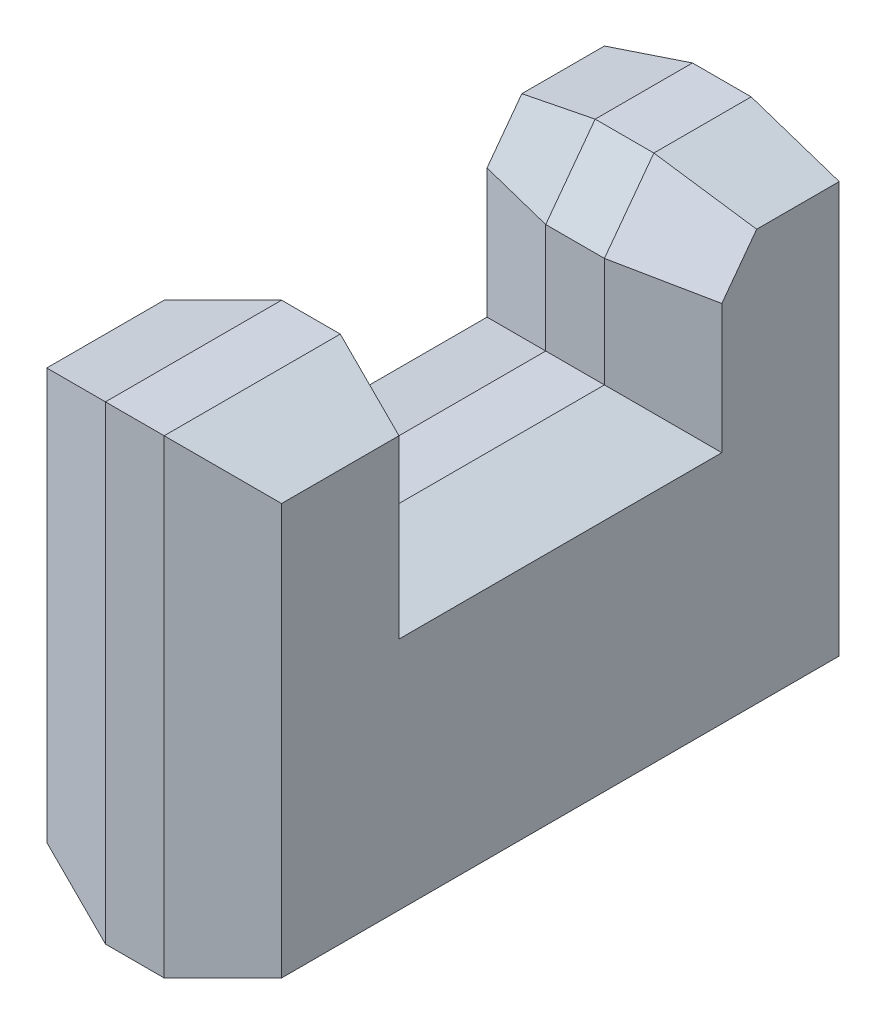
from build123d import *
from OCP.BRepFilletAPI import BRepFilletAPI_MakeChamfer

# Parameters (mm, degrees)
SKETCH1_W               = 4
SKETCH1_H               = 8
BOSS_EXTRUDE1_DEPTH     = 10
CUT_EXTRUDE1_DEPTH      = 11.95445115
CUT_EXTRUDE1_DEPTH_BACK = 11.95445115
CHAMFER4_SIZE           = 0.5
CHAMFER4_SIZE2          = 1.5
CHAMFER5_SIZE           = 1.5
CHAMFER5_SIZE2          = 0.5


with BuildPart() as part:
    # Sketch1 → Boss-Extrude1 (new body)
    with BuildSketch(Plane.XY):
        Rectangle(SKETCH1_W, SKETCH1_H)
    extrude(amount=BOSS_EXTRUDE1_DEPTH)

    # Sketch2 → Cut-Extrude1 (cut, two sides: drawn at the far end of the back side and taken through both)
    with BuildSketch(Plane(origin=(0, 0, 0), x_dir=(0, 0, -1), z_dir=(1, 0, 0)).offset(-CUT_EXTRUDE1_DEPTH_BACK)):
        Polygon((-2.5, 2.866561554), (-1.657909941, 4), (-2.5, 4), (-7, 4), (-7, 1), (-2.5, 1), align=None)
    extrude(amount=CUT_EXTRUDE1_DEPTH + CUT_EXTRUDE1_DEPTH_BACK, mode=Mode.SUBTRACT)

    # Chamfer4
    chamfer4_edges = [part.edges().sort_by_distance(p)[0] for p in [
        (-2, -4, 5),
        (-2, 4, 0.82895497),
        (-2, 3.433280777, 2.07895497),
        (-2, 1.933280777, 2.5),
        (-2, 1, 4.75),
        (-2, 2.5, 7),
        (-2, 4, 8.5),
        (-2, 0, 10),
    ]]
    chamfer4_side = [part.faces().sort_by_distance(p)[0] for p in [
        (-2, -0.537369315, 5.071218277),
    ]]
    chamfer(chamfer4_edges, length=CHAMFER4_SIZE, length2=CHAMFER4_SIZE2, reference=chamfer4_side[0])

    # Chamfer5: one chamfer whose edges measure the first distance from different faces: ONE call of the kernel's chamfer builder (chamfer() names one face for all edges)
    chamfer5_edges_1 = [part.edges().sort_by_distance(p)[0] for p in [
        (2, 4, 0.82895497),
    ]]
    chamfer5_side_1 = [part.faces().sort_by_distance(p)[0] for p in [
        (0.75, 4, 0.82895497),
    ]]
    chamfer5_edges_2 = [part.edges().sort_by_distance(p)[0] for p in [
        (2, 3.433280777, 2.07895497),
    ]]
    chamfer5_side_2 = [part.faces().sort_by_distance(p)[0] for p in [
        (0.75, 3.433280777, 2.07895497),
    ]]
    chamfer5_edges_3 = [part.edges().sort_by_distance(p)[0] for p in [
        (2, 1.933280777, 2.5),
    ]]
    chamfer5_side_3 = [part.faces().sort_by_distance(p)[0] for p in [
        (0.75, 1.933280777, 2.5),
    ]]
    chamfer5_edges_4 = [part.edges().sort_by_distance(p)[0] for p in [
        (2, 1, 4.75),
    ]]
    chamfer5_side_4 = [part.faces().sort_by_distance(p)[0] for p in [
        (0.75, 1, 4.75),
    ]]
    chamfer5_edges_5 = [part.edges().sort_by_distance(p)[0] for p in [
        (2, 2.5, 7),
    ]]
    chamfer5_side_5 = [part.faces().sort_by_distance(p)[0] for p in [
        (0.75, 2.5, 7),
    ]]
    chamfer5_edges_6 = [part.edges().sort_by_distance(p)[0] for p in [
        (2, 4, 8.5),
    ]]
    chamfer5_side_6 = [part.faces().sort_by_distance(p)[0] for p in [
        (0.75, 4, 8.5),
    ]]
    chamfer5_edges_7 = [part.edges().sort_by_distance(p)[0] for p in [
        (2, 0, 10),
    ]]
    chamfer5_side_7 = [part.faces().sort_by_distance(p)[0] for p in [
        (0.75, 0, 10),
    ]]
    chamfer5_edges_8 = [part.edges().sort_by_distance(p)[0] for p in [
        (2, -4, 5),
    ]]
    chamfer5_side_8 = [part.faces().sort_by_distance(p)[0] for p in [
        (0.75, -4, 5),
    ]]
    chamfer5 = BRepFilletAPI_MakeChamfer(part.part.solid().wrapped)
    for e in chamfer5_edges_1:
        chamfer5.Add(CHAMFER5_SIZE, CHAMFER5_SIZE2, e.wrapped, chamfer5_side_1[0].wrapped)  # the first distance lies on this face
    for e in chamfer5_edges_2:
        chamfer5.Add(CHAMFER5_SIZE, CHAMFER5_SIZE2, e.wrapped, chamfer5_side_2[0].wrapped)  # the first distance lies on this face
    for e in chamfer5_edges_3:
        chamfer5.Add(CHAMFER5_SIZE, CHAMFER5_SIZE2, e.wrapped, chamfer5_side_3[0].wrapped)  # the first distance lies on this face
    for e in chamfer5_edges_4:
        chamfer5.Add(CHAMFER5_SIZE, CHAMFER5_SIZE2, e.wrapped, chamfer5_side_4[0].wrapped)  # the first distance lies on this face
    for e in chamfer5_edges_5:
        chamfer5.Add(CHAMFER5_SIZE, CHAMFER5_SIZE2, e.wrapped, chamfer5_side_5[0].wrapped)  # the first distance lies on this face
    for e in chamfer5_edges_6:
        chamfer5.Add(CHAMFER5_SIZE, CHAMFER5_SIZE2, e.wrapped, chamfer5_side_6[0].wrapped)  # the first distance lies on this face
    for e in chamfer5_edges_7:
        chamfer5.Add(CHAMFER5_SIZE, CHAMFER5_SIZE2, e.wrapped, chamfer5_side_7[0].wrapped)  # the first distance lies on this face
    for e in chamfer5_edges_8:
        chamfer5.Add(CHAMFER5_SIZE, CHAMFER5_SIZE2, e.wrapped, chamfer5_side_8[0].wrapped)  # the first distance lies on this face
    add(Compound.cast(chamfer5.Shape()), mode=Mode.REPLACE)


solid = part.part
